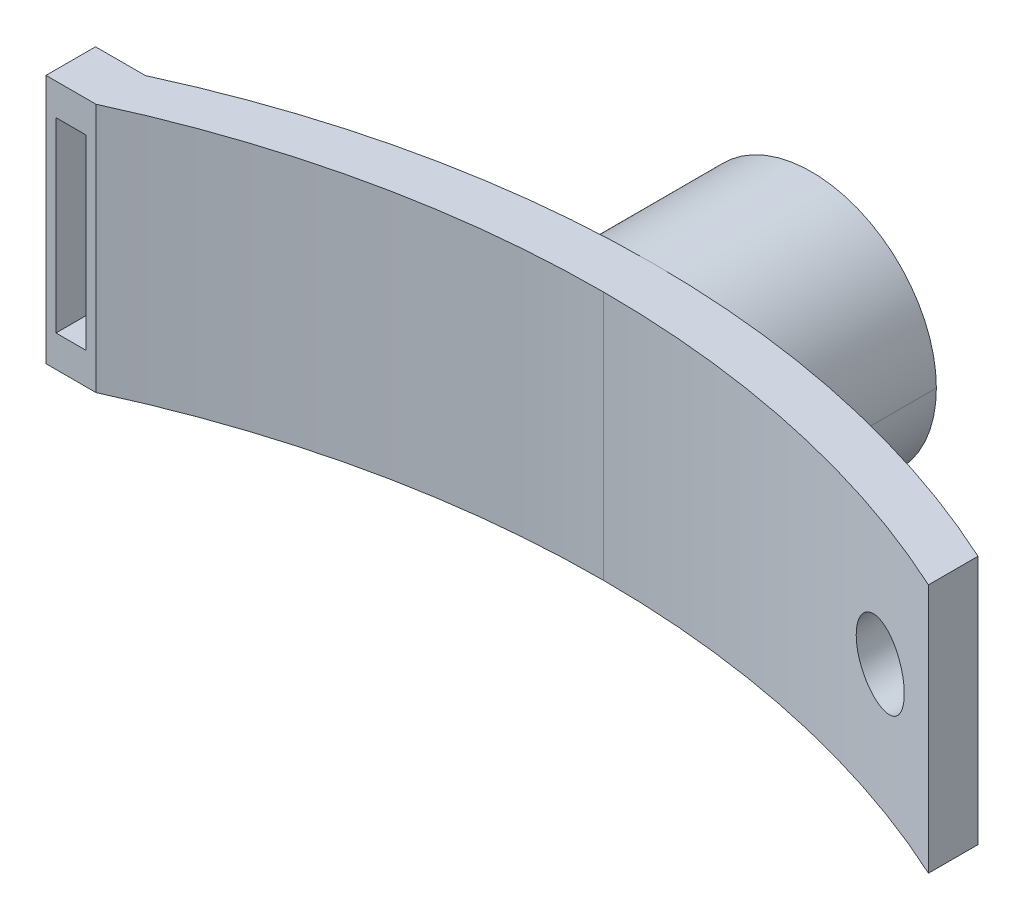
from build123d import *

# Parameters (mm, degrees)
BOSS_EXTRUDE1_START         = -15
BOSS_EXTRUDE1_DEPTH         = 30
BOSS_EXTRUDE1_START_2       = -12.7
BOSS_EXTRUDE1_2_OUTLINE_W   = 6
BOSS_EXTRUDE1_2_OUTLINE_H   = 5.949524979
BOSS_EXTRUDE1_2_DEPTH       = 25.4
BOSS_EXTRUDE1_3_OUTLINE_R   = 15
BOSS_EXTRUDE1_3_OUTLINE_R_2 = 4.55
BOSS_EXTRUDE1_3_DEPTH       = 19.994560744
SKETCH4_W                   = 3.6
SKETCH4_H                   = 22.4
CUT_EXTRUDE1_DEPTH          = 6
BOSS_EXTRUDE2_REACH         = 70.216
BOSS_EXTRUDE2_END_RADIUS    = 119.634966004
SKETCH9_R                   = 6.57997386
SKETCH9_R_2                 = 3.45
SKETCH10_W                  = 5.949524979
SKETCH10_H                  = 2.3
BOSS_EXTRUDE3_DEPTH         = 6


with BuildPart() as part:
    # Boss-Extrude1: read off the stored shape, not the designer's step
    # Boss-Extrude1 outline → Boss-Extrude1 (new body)
    with BuildSketch(Plane(origin=(0, 0, 0), x_dir=(1, 0, 0), z_dir=(0, 1, 0)).offset(BOSS_EXTRUDE1_START)):
        with BuildLine():
            Line((-50, -30), (-50, -35.949524979))
            ThreePointArc((-50, -35.949524979), (-25.592440765, -27.769436157), (0, -25))
            ThreePointArc((0, -25), (25.592440765, -27.769436157), (50, -35.949524979))
            Line((50, -35.949524979), (50, -30))
            ThreePointArc((50, -30), (27.810549479, -22.327809439), (4.550000287, -19.13702996))
            ThreePointArc((4.550000287, -19.13702996), (2.275411741, -19.072115713), (0, -19.050475021))
            ThreePointArc((0, -19.050475021), (-25.592440765, -21.819911178), (-50, -30))
        make_face()
    extrude(amount=BOSS_EXTRUDE1_DEPTH)

    # Boss-Extrude1 2 outline → Boss-Extrude1 2 (add)
    with BuildSketch(Plane(origin=(0, 0, 0), x_dir=(1, 0, 0), z_dir=(0, 1, 0)).offset(BOSS_EXTRUDE1_START_2)):
        with Locations((-53, -32.97476249)):
            Rectangle(BOSS_EXTRUDE1_2_OUTLINE_W, BOSS_EXTRUDE1_2_OUTLINE_H)
    extrude(amount=BOSS_EXTRUDE1_2_DEPTH)

    # Boss-Extrude1 3 outline → Boss-Extrude1 3 (add)
    with BuildSketch(Plane.XY):
        Circle(BOSS_EXTRUDE1_3_OUTLINE_R)
        Circle(BOSS_EXTRUDE1_3_OUTLINE_R_2, mode=Mode.SUBTRACT)
    extrude(amount=BOSS_EXTRUDE1_3_DEPTH)

    # Sketch4 → Cut-Extrude1 (cut)
    with BuildSketch(Plane.XY.offset(35.949524979)):
        with Locations((-53, 0)):
            Rectangle(SKETCH4_W, SKETCH4_H)
    extrude(amount=-CUT_EXTRUDE1_DEPTH, mode=Mode.SUBTRACT)

    # Sketch8 → CBORE for M8 Hex Head Bolt1 (revolve, cut)
    with BuildSketch(Plane.YZ.offset(40.380081118)):
        Polygon((0, 0), (0, 35.949524979), (4.5, 35.949524979), (4.5, 5.68), (9.005, 5.68), (9.005, 0.025), (9.03, 0), align=None)
    revolve(axis=Axis((40.380081118, 0, -6.35), (0, 0, 1)), mode=Mode.SUBTRACT)

    # Boss-Extrude2: up to this cylinder (the profile starts outside it)
    boss_extrude2_end = Plane(origin=(0, 0, 138.685441025), z_dir=(0, -1, 0)) * Cylinder(BOSS_EXTRUDE2_END_RADIUS, 380.701932008, mode=Mode.PRIVATE)
    # Sketch9 → Boss-Extrude2 (add, up to the surface)
    with BuildSketch(Plane(origin=(0, 0, 0), x_dir=(-1, 0, 0), z_dir=(0, 0, -1)), mode=Mode.PRIVATE) as boss_extrude2_sk1:
        Circle(SKETCH9_R)
        Circle(SKETCH9_R_2, mode=Mode.SUBTRACT)
    boss_extrude2_tool1 = extrude(boss_extrude2_sk1.sketch, amount=-BOSS_EXTRUDE2_REACH, mode=Mode.PRIVATE) - boss_extrude2_end
    add(boss_extrude2_tool1.solids().sort_by_distance((6.393864, 0, 0))[0])

    # Sketch10 → Boss-Extrude3 (add)
    with BuildSketch(Plane.ZY.offset(50)):
        with Locations((32.97476249, 13.85)):
            Rectangle(SKETCH10_W, SKETCH10_H)
        with Locations((32.97476249, -13.85)):
            Rectangle(SKETCH10_W, SKETCH10_H)
    extrude(amount=BOSS_EXTRUDE3_DEPTH)


solid = part.part
